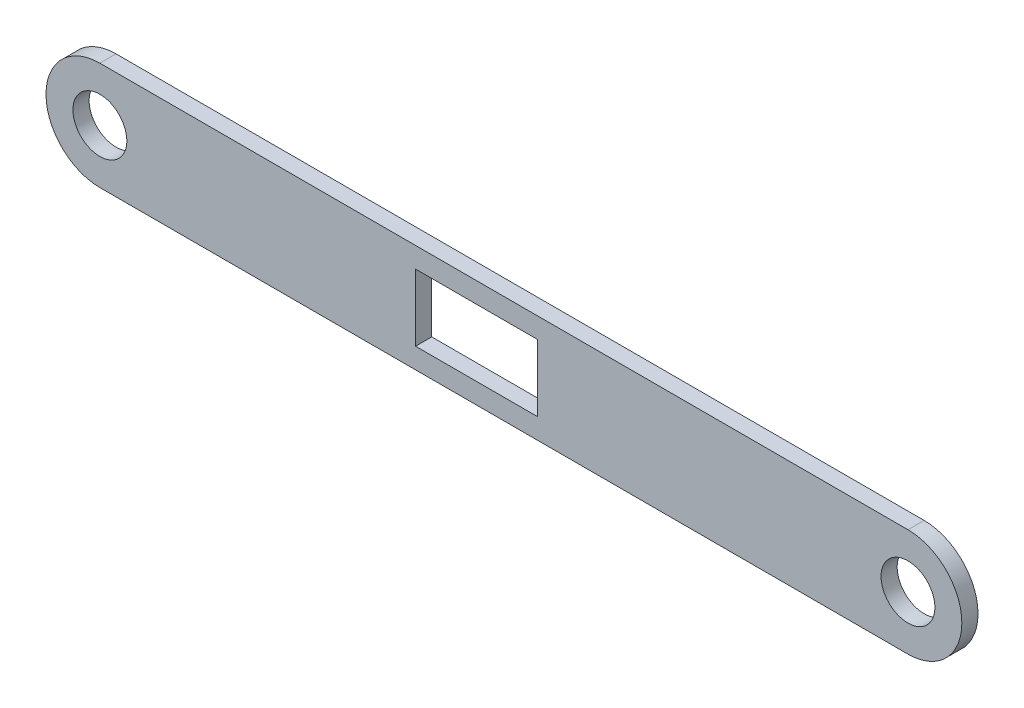
from build123d import *

# Parameters (mm, degrees)
SKETCH1_R           = 5
SKETCH1_W           = 22.6
SKETCH1_H           = 12.4
BOSS_EXTRUDE1_DEPTH = 3


with BuildPart() as part:
    # Sketch1 → Boss-Extrude1 (new body)
    with BuildSketch(Plane.XY):
        with BuildLine():
            Line((75, -10), (-75, -10))
            ThreePointArc((-75, -10), (-85, 0), (-75, 10))
            Line((-75, 10), (75, 10))
            ThreePointArc((75, 10), (85, 0), (75, -10))
        make_face()
        with Locations((75, 0)):
            Circle(SKETCH1_R, mode=Mode.SUBTRACT)
        with Locations((-75, 0)):
            Circle(SKETCH1_R, mode=Mode.SUBTRACT)
        with Locations((-5.1, 0)):
            Rectangle(SKETCH1_W, SKETCH1_H, mode=Mode.SUBTRACT)
    extrude(amount=BOSS_EXTRUDE1_DEPTH)


solid = part.part
